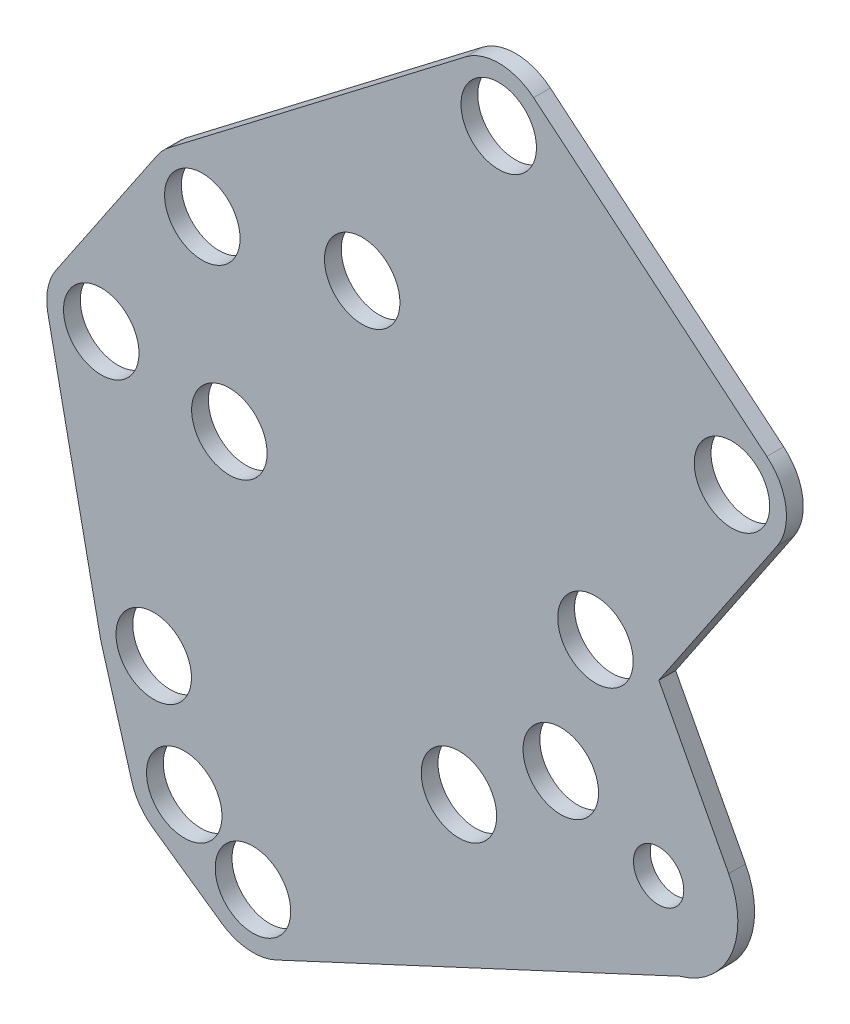
from build123d import *

# Parameters (mm, degrees)
SKETCH18_4_R        = 14.2875
SKETCH18_4_R_2      = 9.525
BOSS_EXTRUDE3_DEPTH = 6.35


with BuildPart() as part:
    # Sketch18<4> → Boss-Extrude3 (new body)
    with BuildSketch(Plane.XY):
        with BuildLine():
            Line((375.176668125, 441.221999251), (336.910074805, 384.489441596))
            ThreePointArc((336.910074805, 384.489441596), (333.773559788, 376.950957952), (333.806084652, 368.786069451))
            Line((333.806084652, 368.786069451), (353.674091198, 272.318549596))
            ThreePointArc((353.674091198, 272.318549596), (353.857989921, 271.508513626), (354.074336604, 270.706534121))
            Line((354.074336604, 270.706534121), (365.631992349, 231.054555926))
            ThreePointArc((365.631992349, 231.054555926), (368.66989863, 224.808685713), (373.607816295, 219.924349686))
            Line((373.607816295, 219.924349686), (399.615893701, 201.713297832))
            ThreePointArc((399.615893701, 201.713297832), (409.6446422, 198.060436162), (420.157101391, 199.906349645))
            Line((420.157101391, 199.906349645), (573.132562, 271.063251825))
            ThreePointArc((573.132562, 271.063251825), (592.600566575, 288.088104399), (591.591367305, 313.930517679))
            Line((591.591367305, 313.930517679), (565.147145922, 364.150898383))
            Line((565.147145922, 364.150898383), (609.934376564, 430.550698422))
            ThreePointArc((609.934376564, 430.550698422), (613.255670118, 445.006306809), (606.023864314, 457.956078603))
            Line((606.023864314, 457.956078603), (517.710321789, 531.427603055))
            ThreePointArc((517.710321789, 531.427603055), (504.93176178, 536.195788322), (491.969671112, 531.951805269))
            Line((491.969671112, 531.951805269), (379.744031006, 446.070894555))
            ThreePointArc((379.744031006, 446.070894555), (377.263420848, 443.831941714), (375.176668125, 441.221999251))
        make_face()
        with Locations((528.012994859, 315.793126506)):
            Circle(SKETCH18_4_R, mode=Mode.SUBTRACT)
        with Locations((402.529885669, 364.368500044)):
            Circle(SKETCH18_4_R, mode=Mode.SUBTRACT)
        with Locations((489.445445962, 288.8243817)):
            Circle(SKETCH18_4_R, mode=Mode.SUBTRACT)
        with Locations((354.019337708, 372.94909805)):
            Circle(SKETCH18_4_R, mode=Mode.SUBTRACT)
        with Locations((392.285931029, 429.681655706)):
            Circle(SKETCH18_4_R, mode=Mode.SUBTRACT)
        with Locations((504.511571135, 515.56256642)):
            Circle(SKETCH18_4_R, mode=Mode.SUBTRACT)
        with Locations((592.825113661, 442.091041967)):
            Circle(SKETCH18_4_R, mode=Mode.SUBTRACT)
        with Locations((541.135279811, 365.457711833)):
            Circle(SKETCH18_4_R, mode=Mode.SUBTRACT)
        with Locations((411.453077406, 218.618548146)):
            Circle(SKETCH18_4_R, mode=Mode.SUBTRACT)
        with Locations((385.445, 236.8296)):
            Circle(SKETCH18_4_R, mode=Mode.SUBTRACT)
        with Locations((373.887344255, 276.481578195)):
            Circle(SKETCH18_4_R, mode=Mode.SUBTRACT)
        with Locations((452.821737286, 438.929236286)):
            Circle(SKETCH18_4_R, mode=Mode.SUBTRACT)
        with Locations((565.046531656, 299.952975083)):
            Circle(SKETCH18_4_R_2, mode=Mode.SUBTRACT)
    extrude(amount=BOSS_EXTRUDE3_DEPTH)


solid = part.part
